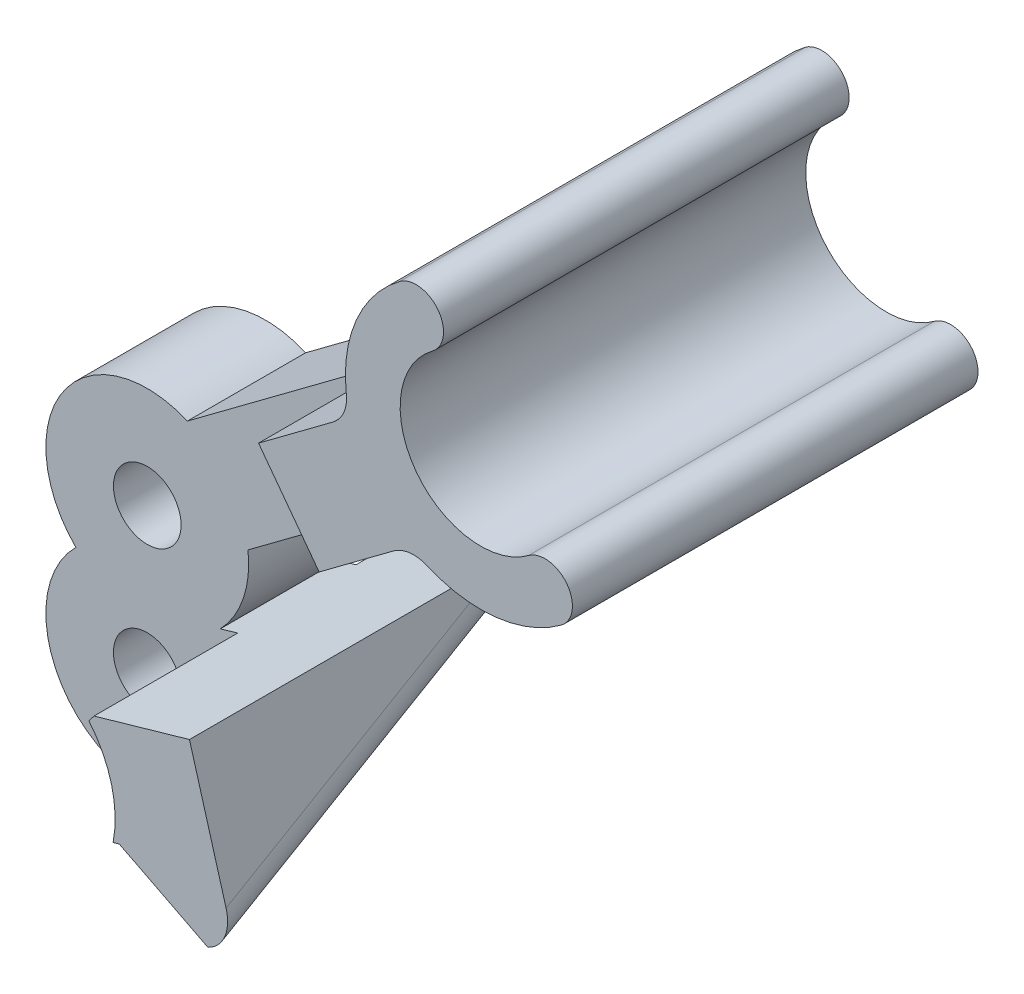
from build123d import *

# Parameters (mm, degrees)
SKETCH1_R            = 1
BOSS_EXTRUDE1_DEPTH  = 12
CUT_EXTRUDE1_DEPTH   = 4.25
CUT_EXTRUDE3_DEPTH   = 4.25
CUT_EXTRUDE2_START   = -3.551923789
CUT_EXTRUDE2_DEPTH   = 3.551923789
CUT_EXTRUDE2_START_2 = 4.25
CUT_EXTRUDE2_2_DEPTH = 3.5
FILLET8_R            = 1
FILLET9_R            = 1


with BuildPart() as part:
    # Sketch1 → Boss-Extrude1 (new body)
    with BuildSketch(Plane.XY):
        with BuildLine():
            Line((1.186636508, 7.015339144), (10.241749958, 13.764812698))
            ThreePointArc((10.241749958, 13.764812698), (10.336328118, 16.101061111), (11.720750751, 17.985305164))
            ThreePointArc((11.720750751, 17.985305164), (12.854265392, 17.819943261), (12.688903489, 16.68642862))
            ThreePointArc((12.688903489, 16.68642862), (12.203025305, 13.355854737), (15.533599188, 12.869976553))
            ThreePointArc((15.533599188, 12.869976553), (16.667113829, 12.704614651), (16.501751927, 11.57110001))
            ThreePointArc((16.501751927, 11.57110001), (14.300524873, 10.782683155), (12.034625399, 11.359485765))
            Line((12.034625399, 11.359485765), (2.979511949, 4.610012211))
            ThreePointArc((2.979511949, 4.610012211), (2.843457612, 3.303574986), (2.162315925, 2.180483268))
            Line((2.162315925, 2.180483268), (5.498303396, 3.137062282))
            Line((5.498303396, 3.137062282), (6.325215464, 0.253277194))
            Line((6.325215464, 0.253277194), (6.880438917, -1.683017096))
            Line((6.880438917, -1.683017096), (6.052988912, -1.920284566))
            Line((6.052988912, -1.920284566), (3.421928238, -0.579227021))
            Line((3.421928238, -0.579227021), (2.910887179, -0.725765687))
            ThreePointArc((2.910887179, -0.725765687), (-1.48262032, -2.608033164), (-2.112605027, 2.13))
            ThreePointArc((-2.112605027, 2.13), (-2.486159501, 5.938991047), (1.186636508, 7.015339144))
        make_face()
        with Locations((0, 4.26)):
            Circle(SKETCH1_R, mode=Mode.SUBTRACT)
        Circle(SKETCH1_R, mode=Mode.SUBTRACT)
    extrude(amount=BOSS_EXTRUDE1_DEPTH)

    # Sketch2 → Cut-Extrude1 (cut)
    with BuildSketch(Plane.XY.offset(12)):
        with BuildLine():
            ThreePointArc((2.520535657, 2.13), (0, 7.56), (-2.520535657, 2.13))
            ThreePointArc((-2.520535657, 2.13), (0, -3.3), (2.520535657, 2.13))
        make_face()
    cut_extrude1 = extrude(amount=-CUT_EXTRUDE1_DEPTH, mode=Mode.SUBTRACT)

    # Sketch4 → Cut-Extrude3 (cut)
    with BuildSketch(Plane.XY.offset(12)):
        Polygon((7.542328095, 11.752725651), (9.335203536, 9.347398719), (2.498013424, 4.251114272), (0.705137983, 6.656441205), align=None)
    cut_extrude3 = extrude(amount=-CUT_EXTRUDE3_DEPTH, mode=Mode.SUBTRACT)

    # Mirror1: Cut-Extrude1, Cut-Extrude3 across plane
    add(cut_extrude1.mirror(Plane.XY.offset(6)), mode=Mode.SUBTRACT)
    add(cut_extrude3.mirror(Plane.XY.offset(6)), mode=Mode.SUBTRACT)

    # Cut-Extrude2: read off the stored shape, not the designer's step
    # Cut-Extrude2 outline → Cut-Extrude2 (cut)
    with BuildSketch(Plane(origin=(5.91175943, 1.695169738, 0), x_dir=(0, 0, -1), z_dir=(0.9612616959383197, 0.27563735581699633, 0)).offset(CUT_EXTRUDE2_START)):
        Polygon((0, 1.5), (-12, -3.514325857), (0, -3.514325857), align=None)
    extrude(amount=CUT_EXTRUDE2_DEPTH, mode=Mode.SUBTRACT)

    # Cut-Extrude2 2 outline → Cut-Extrude2 2 (add)
    with BuildSketch(Plane.XY.offset(CUT_EXTRUDE2_START_2)):
        with BuildLine():
            ThreePointArc((2.910887178, -0.725765687), (2.998773461, -0.085777187), (2.947613523, 0.558188603))
            Line((2.947613523, 0.558188603), (2.674578173, 2))
            Line((2.674578173, 2), (2.129286445, 2))
            Line((2.129286445, 2), (2.573481441, 0.450907955))
            Line((2.573481441, 0.450907955), (2.910887178, -0.725765687))
        make_face()
    extrude(amount=CUT_EXTRUDE2_2_DEPTH)

    # Fillet8
    fillet8_edges = [part.edges().sort_by_distance(p)[0] for p in [
        (10.241749958, 13.764812698, 6),
        (12.034625399, 11.359485765, 6),
    ]]
    fillet(fillet8_edges, radius=FILLET8_R)

    # Fillet9
    fillet9_edges = [part.edges().sort_by_distance(p)[0] for p in [
        (6.189371157, 0.727022594, 6),
    ]]
    fillet(fillet9_edges, radius=FILLET9_R)


solid = part.part
